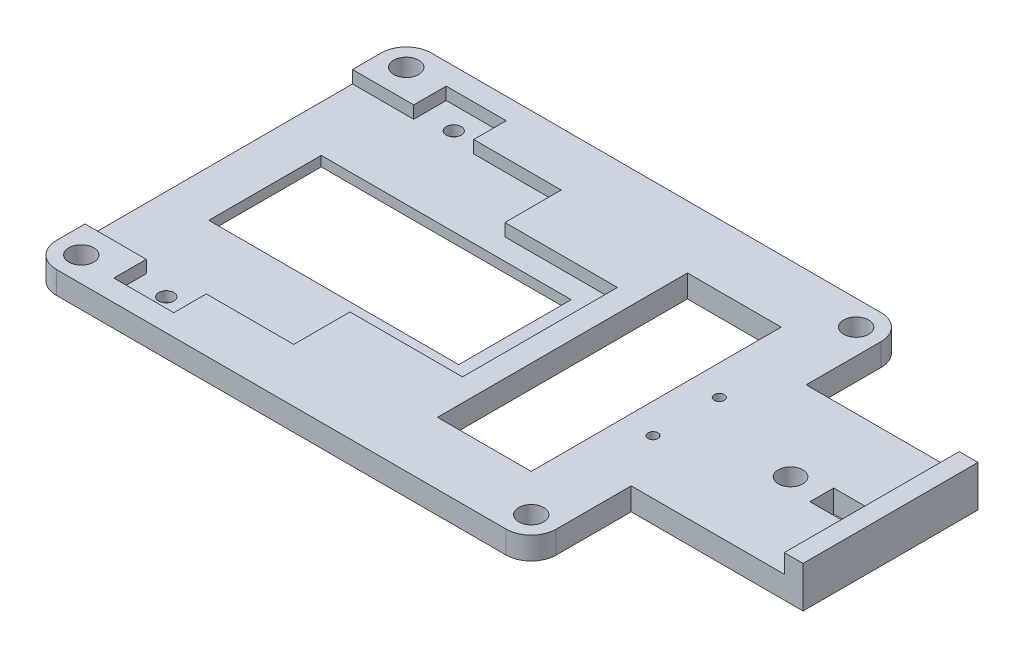
from build123d import *

# Parameters (mm, degrees)
SKETCH2_W                = 136.525
SKETCH2_H                = 76.2
CHASSIS_BASE_DEPTH       = 4.572
SKETCH2_2_W              = 136.525
SKETCH2_2_H              = 76.2
BOSS_EXTRUDE2_DEPTH      = 4.572
SKETCH4_W                = 34.925
SKETCH4_H                = 20.32
CORNER_CUTOUTS_DEPTH     = 79.308888961
CUT_EXTRUDE2_DEPTH       = 2.54
CIRCLE_R                 = 1.524
CIRCLE_THROUGH_ALL_DEPTH = 79.216561585
FILLET4_R                = 5.08
SKETCH10_W               = 50.8
SKETCH10_H               = 22.86
RESISTANCE_SENSOR_DEPTH  = 79.216561585
SKETCH11_R               = 2.54
CORNER_HOLES_DEPTH       = 79.308888961
CUT_EXTRUDE7_DEPTH       = 79.216561585
CUT_EXTRUDE7_DEPTH_BACK  = 79.216561585
SKETCH12_R               = 1.016
SKETCH12_W               = 19.05
SKETCH12_H               = 50.8
SKETCH16_W               = 6.35
SKETCH16_H               = 4.826
CUT_EXTRUDE11_DEPTH      = 79.308888961
SKETCH17_R               = 2.4892
CUT_EXTRUDE12_DEPTH      = 79.308888961
CUT_EXTRUDE13_DEPTH      = 1.27
SKETCH19_W               = 3.81
SKETCH19_H               = 35.56
BOSS_EXTRUDE4_DEPTH      = 3.81


with BuildPart() as part:
    # Sketch2 → Chassis Base (new body)
    with BuildSketch(Plane(origin=(0, 0, 0), x_dir=(1, 0, 0), z_dir=(0, 1, 0))):
        Rectangle(SKETCH2_W, SKETCH2_H)
    extrude(amount=CHASSIS_BASE_DEPTH)

    # Sketch2<2> → Boss-Extrude2 (add)
    with BuildSketch(Plane(origin=(0, 0, 0), x_dir=(1, 0, 0), z_dir=(0, 1, 0))):
        Rectangle(SKETCH2_2_W, SKETCH2_2_H)
    extrude(amount=BOSS_EXTRUDE2_DEPTH)

    # Sketch4 → Corner Cutouts (cut, through all)
    with BuildSketch(Plane.XZ):
        with Locations((50.8, -27.94)):
            Rectangle(SKETCH4_W, SKETCH4_H)
        with Locations((50.8, 27.94)):
            Rectangle(SKETCH4_W, SKETCH4_H)
    extrude(amount=-CORNER_CUTOUTS_DEPTH, mode=Mode.SUBTRACT)

    # Lines → Cut-Extrude2 (cut)
    with BuildSketch(Plane(origin=(0, 4.572, 0), x_dir=(1, 0, 0), z_dir=(0, 1, 0))):
        Polygon((-68.2625, -27.178), (-55.8165, -27.178), (-55.8165, -33.782), (-43.6245, -33.782), (-43.6245, -27.178), (-25.8445, -27.178), (-25.8445, -15.748), (-2.9845, -15.748), (-2.9845, 15.748), (-25.8445, 15.748), (-25.8445, 27.178), (-43.6245, 27.178), (-43.6245, 33.782), (-55.8165, 33.782), (-55.8165, 27.178), (-68.2625, 27.178), align=None)
    extrude(amount=-CUT_EXTRUDE2_DEPTH, mode=Mode.SUBTRACT)

    # Circle → Circle Through All (cut, through all)
    with BuildSketch(Plane(origin=(0, 2.032, 0), x_dir=(1, 0, 0), z_dir=(0, 1, 0))):
        with Locations((-49.7205, -29.21)):
            Circle(CIRCLE_R)
        with Locations((-49.7205, 29.21)):
            Circle(CIRCLE_R)
    extrude(amount=-CIRCLE_THROUGH_ALL_DEPTH, mode=Mode.SUBTRACT)

    # Fillet4
    fillet4_edges = [part.edges().sort_by_distance(p)[0] for p in [
        (33.3375, 2.286, -38.1),
        (-68.2625, 2.286, -38.1),
        (-68.2625, 2.286, 38.1),
        (33.3375, 2.286, 38.1),
    ]]
    fillet(fillet4_edges, radius=FILLET4_R)

    # Sketch10 → resistance sensor (cut, through all)
    with BuildSketch(Plane(origin=(0, 2.032, 0), x_dir=(1, 0, 0), z_dir=(0, 1, 0))):
        with Locations((-33.4645, 0)):
            Rectangle(SKETCH10_W, SKETCH10_H)
    extrude(amount=-RESISTANCE_SENSOR_DEPTH, mode=Mode.SUBTRACT)

    # Sketch11 → corner holes (cut, through all)
    with BuildSketch(Plane(origin=(0, 4.572, 0), x_dir=(1, 0, 0), z_dir=(0, 1, 0))):
        with Locations((-63.1825, 33.02)):
            Circle(SKETCH11_R)
        with Locations((28.2575, 33.02)):
            Circle(SKETCH11_R)
        with Locations((-63.1825, -33.02)):
            Circle(SKETCH11_R)
        with Locations((28.2575, -33.02)):
            Circle(SKETCH11_R)
    extrude(amount=-CORNER_HOLES_DEPTH, mode=Mode.SUBTRACT)

    # Sketch12 → Cut-Extrude7 (cut, two sides: drawn at the far end of the back side and taken through both)
    with BuildSketch(Plane(origin=(0, 2.032, 0), x_dir=(1, 0, 0), z_dir=(0, 1, 0)).offset(-CUT_EXTRUDE7_DEPTH_BACK)):
        with Locations((26.7335, -6.731)):
            Circle(SKETCH12_R)
        with Locations((26.7335, 6.731)):
            Circle(SKETCH12_R)
        with Locations((11.1125, 0)):
            Rectangle(SKETCH12_W, SKETCH12_H)
    extrude(amount=CUT_EXTRUDE7_DEPTH + CUT_EXTRUDE7_DEPTH_BACK, mode=Mode.SUBTRACT)

    # Sketch16 → Cut-Extrude11 (cut, through all)
    with BuildSketch(Plane(origin=(0, 4.572, 0), x_dir=(1, 0, 0), z_dir=(0, 1, 0))):
        with Locations((57.4675, 0)):
            Rectangle(SKETCH16_W, SKETCH16_H)
    extrude(amount=-CUT_EXTRUDE11_DEPTH, mode=Mode.SUBTRACT)

    # Sketch17 → Cut-Extrude12 (cut, through all)
    with BuildSketch(Plane(origin=(0, 4.572, 0), x_dir=(1, 0, 0), z_dir=(0, 1, 0))):
        with Locations((47.9425, 0)):
            Circle(SKETCH17_R)
    extrude(amount=-CUT_EXTRUDE12_DEPTH, mode=Mode.SUBTRACT)

    # Sketch18 → Cut-Extrude13 (cut)
    # profile 1 of 5: a face of its own
    with BuildSketch(Plane.XZ):
        with BuildLine():
            add(Edge.make_bspline(
                [(-33.702772205, -32.937203509), (-33.703598143, -33.02845504), (-33.705333053, -33.220131806), (-33.705378986, -33.521319359), (-33.709066322, -33.849800879), (-33.712761289, -34.138175691), (-33.714963296, -34.374614628), (-33.718439752, -34.546867394), (-33.721526048, -34.710761461), (-33.724612791, -34.865938747), (-33.72789546, -35.013090421), (-33.730587927, -35.151550246), (-33.735112427, -35.281601123), (-33.737993241, -35.365288069), (-33.739385689, -35.405738309)],
                knots=[0, 0, 0, 0, 1.330626348, 2.7950233, 4.391685999, 6.12059717, 7.000305762, 7.839416787, 8.632773681, 9.390544697, 10.102563453, 10.778998041, 11.409826442, 12, 12, 12, 12], degree=3))
            add(Edge.make_bspline(
                [(-33.739385689, -35.405738309), (-33.768327502, -35.409234362), (-33.83248073, -35.416983812), (-33.938141271, -35.429526589), (-34.062641053, -35.444079448), (-34.199605701, -35.460468397), (-34.336402659, -35.474890146), (-34.460092543, -35.489102134), (-34.564431712, -35.49920428), (-34.627550021, -35.505459716), (-34.65579444, -35.508258922)],
                knots=[0, 0, 0, 0, 0.75871927, 1.681798207, 2.769238559, 4.021041382, 5.271823924, 6.349219828, 7.26130266, 8, 8, 8, 8], degree=3))
            Line((-34.65579444, -35.508258922), (-34.690872443, -35.633794368))
            Line((-34.690872443, -35.633794368), (-31.888414176, -35.633794368))
            Line((-31.888414176, -35.633794368), (-31.917958117, -35.508258922))
            add(Edge.make_bspline(
                [(-31.917958117, -35.508258922), (-31.94519292, -35.505432324), (-32.007975814, -35.498916323), (-32.114793949, -35.488841023), (-32.24651708, -35.474708008), (-32.395177404, -35.460442989), (-32.543351452, -35.444452526), (-32.674806168, -35.429726522), (-32.781201209, -35.417460189), (-32.843906764, -35.409283924), (-32.871098858, -35.405738309)],
                knots=[0, 0, 0, 0, 0.685471795, 1.5801805, 2.685974342, 4.001975441, 5.318873838, 6.416921702, 7.313502363, 8, 8, 8, 8], degree=3))
            add(Edge.make_bspline(
                [(-32.871098858, -35.405738309), (-32.874138312, -35.320659894), (-32.880589906, -35.140071021), (-32.885476038, -34.853018948), (-32.894092619, -34.53434684), (-32.898315756, -34.19327846), (-32.902545611, -33.849452346), (-32.905663218, -33.522012459), (-32.907865964, -33.221075479), (-32.908471188, -33.02928289), (-32.908759492, -32.937920679)],
                knots=[0, 0, 0, 0, 0.827787113, 1.757074824, 2.79152534, 3.927552477, 5.073705597, 6.13505851, 7.111617519, 8, 8, 8, 8], degree=3))
            Line((-32.908759492, -32.937920679), (-32.907714385, -32.60758102))
            add(Edge.make_bspline(
                [(-32.907714385, -32.60758102), (-32.907861914, -32.531482837), (-32.908168994, -32.373085708), (-32.90565813, -32.126816918), (-32.902343534, -31.862847889), (-32.899826982, -31.634770862), (-32.894883149, -31.452080957), (-32.893441615, -31.324776533), (-32.890456586, -31.20968499), (-32.885676819, -31.107210678), (-32.882771665, -31.016875079), (-32.880052488, -30.938721487), (-32.875690702, -30.872484003), (-32.87252916, -30.8324094), (-32.871098858, -30.814279395)],
                knots=[0, 0, 0, 0, 1.527084951, 3.178602462, 4.942148896, 6.824739446, 7.755670849, 8.60950548, 9.379539168, 10.065885191, 10.668053807, 11.193301322, 11.635044395, 12, 12, 12, 12], degree=3))
            add(Edge.make_bspline(
                [(-32.871098858, -30.814279395), (-32.775178336, -30.816375101), (-32.582476854, -30.820585312), (-32.292786393, -30.839576476), (-32.001201884, -30.870593955), (-31.759192401, -30.903372857), (-31.571970644, -30.935633002), (-31.443807878, -30.959247373), (-31.329128742, -30.984449322), (-31.227090289, -31.009248014), (-31.138232094, -31.034937095), (-31.062429595, -31.062177121), (-30.999371199, -31.089458511), (-30.96348015, -31.111044647), (-30.947268158, -31.120795108)],
                knots=[0, 0, 0, 0, 1.761064907, 3.537927135, 5.327106968, 7.14307567, 8.01968469, 8.81438351, 9.535076163, 10.174712332, 10.74185694, 11.231870149, 11.653035633, 12, 12, 12, 12], degree=3))
            add(Edge.make_bspline(
                [(-30.947268158, -31.120795108), (-30.946391758, -31.143458533), (-30.944531559, -31.191562689), (-30.94543048, -31.268999734), (-30.944897718, -31.355826869), (-30.946533225, -31.486265533), (-30.951334144, -31.66062272), (-30.956246741, -31.802874042), (-30.958775574, -31.876100037)],
                knots=[0, 0, 0, 0, 0.540260251, 1.146727055, 1.844579267, 2.608938745, 4.254400499, 6, 6, 6, 6], degree=3))
            Line((-30.958775574, -31.876100037), (-30.832195022, -31.919036265))
            add(Edge.make_bspline(
                [(-30.832195022, -31.919036265), (-30.830117163, -31.896702772), (-30.825474294, -31.846799741), (-30.817475281, -31.76475329), (-30.805186845, -31.66832746), (-30.792868066, -31.557758279), (-30.779786175, -31.432781757), (-30.762290679, -31.294163583), (-30.7449934, -31.140982052), (-30.725461629, -30.97887355), (-30.706363399, -30.817020179), (-30.687561291, -30.665674785), (-30.669967123, -30.52964835), (-30.652898401, -30.409435499), (-30.638498637, -30.304389663), (-30.625125277, -30.214725705), (-30.612474102, -30.140517028), (-30.604513088, -30.096281615), (-30.600999555, -30.076758654)],
                knots=[0, 0, 0, 0, 0.579771428, 1.295469156, 2.130605229, 3.092125012, 4.171097047, 5.378518324, 6.703360754, 8.155632211, 9.598953579, 10.915923518, 12.097637568, 13.14415905, 14.054286067, 14.838241834, 15.487266906, 16, 16, 16, 16], degree=3))
            Line((-30.600999555, -30.076758654), (-30.781578329, -30.105475091))
            add(Edge.make_bspline(
                [(-30.781578329, -30.105475091), (-30.789518553, -30.143998715), (-30.806198417, -30.224924501), (-30.828331171, -30.345683623), (-30.849565879, -30.457079623), (-30.864513215, -30.52557071), (-30.870900762, -30.554839475)],
                knots=[0, 0, 0, 0, 1.030142935, 2.16400017, 3.215409641, 4, 4, 4, 4], degree=3))
            add(Edge.make_bspline(
                [(-30.870900762, -30.554839475), (-30.883445808, -30.556323123), (-30.914744569, -30.560024692), (-30.971651332, -30.563720773), (-31.04801904, -30.56788432), (-31.143925294, -30.571994272), (-31.259375172, -30.575769834), (-31.394276438, -30.581781204), (-31.549156013, -30.585026556), (-31.783795056, -30.592748084), (-32.095186039, -30.600485644), (-32.481227455, -30.606461873), (-32.878761634, -30.610774302), (-33.147973164, -30.611837885), (-33.284319699, -30.612376554)],
                knots=[0, 0, 0, 0, 0.188322618, 0.469847995, 0.849958105, 1.328735339, 1.901024075, 2.572223004, 3.341983892, 4.21063745, 6.072535026, 7.986090696, 9.967090691, 12, 12, 12, 12], degree=3))
            add(Edge.make_bspline(
                [(-33.284319699, -30.612376554), (-33.533303403, -30.610894644), (-34.02225272, -30.607984498), (-34.566956607, -30.596874691), (-34.912428586, -30.585010848), (-35.062078606, -30.581752933), (-35.193491765, -30.575756484), (-35.306850432, -30.571985279), (-35.402056205, -30.567834621), (-35.479468612, -30.563644403), (-35.538808582, -30.559958994), (-35.572210829, -30.55632018), (-35.585802864, -30.554839475)],
                knots=[0, 0, 0, 0, 3.244040555, 6.37058324, 7.0978683, 7.747816289, 8.32072437, 8.811738682, 9.225579453, 9.562275481, 9.82188124, 10, 10, 10, 10], degree=3))
            add(Edge.make_bspline(
                [(-35.585802864, -30.554839475), (-35.590559934, -30.513365183), (-35.600382748, -30.427725451), (-35.610618123, -30.301358685), (-35.619859633, -30.185947443), (-35.624570523, -30.114772548), (-35.626601884, -30.084081555)],
                knots=[0, 0, 0, 0, 1.059980831, 2.188740799, 3.218975397, 4, 4, 4, 4], degree=3))
            Line((-35.626601884, -30.084081555), (-35.778291568, -30.054858399))
            add(Edge.make_bspline(
                [(-35.778291568, -30.054858399), (-35.779109696, -30.1315546), (-35.780779991, -30.288138198), (-35.787694661, -30.52777808), (-35.802252217, -30.777410364), (-35.819070712, -31.030610979), (-35.839855131, -31.2738087), (-35.855139777, -31.494046279), (-35.872885045, -31.683923455), (-35.882635398, -31.800772007), (-35.887087933, -31.854131334)],
                knots=[0, 0, 0, 0, 1.020902502, 2.08428298, 3.190586408, 4.348989111, 5.461787099, 6.439309197, 7.287304727, 8, 8, 8, 8], degree=3))
            Line((-35.887087933, -31.854131334), (-35.725192363, -31.809162102))
            add(Edge.make_bspline(
                [(-35.725192363, -31.809162102), (-35.71545437, -31.74706555), (-35.695910507, -31.622439619), (-35.665327308, -31.440288698), (-35.635518725, -31.271767194), (-35.606395568, -31.168052242), (-35.593125765, -31.120795108)],
                knots=[0, 0, 0, 0, 1.07526635, 2.158027564, 3.160715617, 4, 4, 4, 4], degree=3))
            add(Edge.make_bspline(
                [(-35.593125765, -31.120795108), (-35.580361155, -31.112201424), (-35.552835473, -31.093669953), (-35.504809627, -31.068556822), (-35.44731879, -31.043847269), (-35.38048627, -31.01918181), (-35.304711923, -30.993420032), (-35.219034508, -30.970551023), (-35.124453848, -30.944772249), (-35.019973119, -30.919513038), (-34.904098663, -30.896616073), (-34.776123041, -30.875510362), (-34.635107521, -30.858141399), (-34.480918893, -30.843472759), (-34.313785766, -30.832525065), (-34.133859008, -30.822847413), (-33.940979163, -30.816637469), (-33.808085796, -30.815082992), (-33.739385689, -30.814279395)],
                knots=[0, 0, 0, 0, 0.389041187, 0.838930788, 1.368286178, 1.971244365, 2.640738876, 3.392006404, 4.213672846, 5.120859182, 6.110426022, 7.200997897, 8.401287125, 9.703895375, 11.118645378, 12.637995816, 14.261989656, 16, 16, 16, 16], degree=3))
            add(Edge.make_bspline(
                [(-33.739385689, -30.814279395), (-33.737942282, -30.830664591), (-33.734658791, -30.867937979), (-33.730430536, -30.930351173), (-33.727743346, -31.005717111), (-33.724503155, -31.093587246), (-33.721396793, -31.194367242), (-33.718365122, -31.308049063), (-33.71488523, -31.434966911), (-33.712742323, -31.618756603), (-33.708988428, -31.849591328), (-33.705457404, -32.117398445), (-33.70501216, -32.368478864), (-33.704206333, -32.530279453), (-33.703817312, -32.608390135)],
                knots=[0, 0, 0, 0, 0.329934336, 0.750541551, 1.254589287, 1.842509769, 2.514318579, 3.277018032, 4.123623988, 5.061003967, 6.963739231, 8.754478227, 10.433195345, 12, 12, 12, 12], degree=3))
            Line((-33.703817312, -32.608390135), (-33.702772205, -32.937203509))
        make_face()
    # profile 2 of 5: a face of its own
    with BuildSketch(Plane.XZ):
        with BuildLine():
            add(Edge.make_bspline(
                [(-27.251898172, -35.767698843), (-27.14067772, -35.764311776), (-26.922618032, -35.757671068), (-26.603830965, -35.716600121), (-26.29995869, -35.655080644), (-26.012210018, -35.566590368), (-25.739973448, -35.454956469), (-25.484537959, -35.317447754), (-25.243276324, -35.158734883), (-25.058153285, -35.004443988), (-24.918608884, -34.871624623), (-24.821536956, -34.765448835), (-24.73028793, -34.655561965), (-24.645253494, -34.541149573), (-24.566386092, -34.422046989), (-24.495969307, -34.29686386), (-24.429098445, -34.168454969), (-24.37125937, -34.03416413), (-24.318119325, -33.895936844), (-24.274151327, -33.752229577), (-24.233417449, -33.604654162), (-24.201673879, -33.451490367), (-24.175027198, -33.29383193), (-24.15719632, -33.131349802), (-24.142449612, -32.964669116), (-24.139507996, -32.851822621), (-24.138016377, -32.794601046)],
                knots=[0, 0, 0, 0, 1.654520043, 3.24386492, 4.775090929, 6.261827658, 7.715597549, 9.145277746, 10.571150381, 12.004552925, 12.72368617, 13.435937959, 14.143336704, 14.847838136, 15.555750295, 16.266773003, 16.983694851, 17.708494173, 18.440755566, 19.185660995, 19.943230337, 20.717524926, 21.511536697, 22.321039648, 23.148642092, 24, 24, 24, 24], degree=3))
            add(Edge.make_bspline(
                [(-24.138016377, -32.794601046), (-24.140608697, -32.706567622), (-24.145780113, -32.530949878), (-24.188341569, -32.270081443), (-24.256306284, -32.013806886), (-24.335599704, -31.805961834), (-24.411662626, -31.644829689), (-24.475552614, -31.528458756), (-24.546054751, -31.417207878), (-24.622286016, -31.310483813), (-24.705022118, -31.208407771), (-24.795273204, -31.112744285), (-24.890649221, -31.02087723), (-24.958527768, -30.964177657), (-24.992703534, -30.935630326)],
                knots=[0, 0, 0, 0, 1.497468564, 2.987297775, 4.485800779, 6.00346457, 6.76531872, 7.516957734, 8.261133263, 9.005498066, 9.747896811, 10.495259908, 11.242387355, 12, 12, 12, 12], degree=3))
            add(Edge.make_bspline(
                [(-24.992703534, -30.935630326), (-25.070246118, -30.885909145), (-25.222151893, -30.788505447), (-25.46169693, -30.67203661), (-25.70152636, -30.578019856), (-25.946993732, -30.513524114), (-26.197838356, -30.469689092), (-26.457591706, -30.437773454), (-26.728005827, -30.421213243), (-26.911981221, -30.421028741), (-27.005455175, -30.420935)],
                knots=[0, 0, 0, 0, 1.045468158, 2.048070122, 3.019776725, 3.967121396, 4.925071677, 5.910597291, 6.938419277, 8, 8, 8, 8], degree=3))
            add(Edge.make_bspline(
                [(-27.005455175, -30.420935), (-27.067546223, -30.422967782), (-27.19008247, -30.426979464), (-27.371116469, -30.439978031), (-27.546831513, -30.456762048), (-27.71694268, -30.482701932), (-27.88164765, -30.512809725), (-28.041245371, -30.54746318), (-28.194098466, -30.591900434), (-28.342995206, -30.637320101), (-28.485415938, -30.693076932), (-28.62356261, -30.751716604), (-28.755286785, -30.817985236), (-28.881711554, -30.889502), (-29.00262107, -30.966555992), (-29.118323138, -31.049543348), (-29.228384901, -31.138584721), (-29.366176208, -31.264407076), (-29.523971995, -31.431248144), (-29.691760883, -31.64365229), (-29.832359501, -31.869379538), (-29.949688599, -32.105407946), (-30.039676747, -32.353732723), (-30.104302518, -32.613159857), (-30.146663933, -32.883546862), (-30.152426812, -33.068179332), (-30.155348724, -33.161792223)],
                knots=[0, 0, 0, 0, 0.955876937, 1.886416398, 2.792499174, 3.671270352, 4.533252654, 5.369032349, 6.182765502, 6.982075569, 7.763369315, 8.534891058, 9.290804328, 10.030916141, 10.769236196, 11.495940819, 12.220840406, 12.946355399, 14.365929964, 15.749574664, 17.104431243, 18.45069603, 19.798521208, 21.15982306, 22.559965237, 24, 24, 24, 24], degree=3))
            add(Edge.make_bspline(
                [(-30.155348724, -33.161792223), (-30.15430078, -33.247295021), (-30.152242406, -33.415239842), (-30.12544672, -33.661577318), (-30.080784096, -33.897628672), (-30.015676038, -34.124589938), (-29.927459876, -34.345973854), (-29.807685562, -34.560273908), (-29.664977474, -34.774936399), (-29.550121962, -34.908262158), (-29.491056992, -34.976825537)],
                knots=[0, 0, 0, 0, 1.034515342, 2.031997759, 2.994717118, 3.939165266, 4.885977753, 5.871954466, 6.905642885, 8, 8, 8, 8], degree=3))
            add(Edge.make_bspline(
                [(-29.491056992, -34.976825537), (-29.448662443, -35.017134707), (-29.365323353, -35.096374365), (-29.233306218, -35.204229185), (-29.100080082, -35.302769582), (-28.96386678, -35.390007201), (-28.824948465, -35.465156686), (-28.685050486, -35.531750493), (-28.541914085, -35.586442729), (-28.349186902, -35.643489326), (-28.107923503, -35.698404191), (-27.819876596, -35.743318797), (-27.534927157, -35.768959701), (-27.346192823, -35.768117594), (-27.251898172, -35.767698843)],
                knots=[0, 0, 0, 0, 0.861291258, 1.693124039, 2.508722345, 3.300843965, 4.073052942, 4.833508039, 5.581284352, 6.327029741, 7.792114048, 9.221606161, 10.61839766, 12, 12, 12, 12], degree=3))
        make_face()
        with BuildLine():
            add(Edge.make_bspline(
                [(-26.895829263, -35.508258922), (-26.984523637, -35.502704186), (-27.158480619, -35.491809638), (-27.412028501, -35.445592731), (-27.652978609, -35.378433913), (-27.880543049, -35.285047473), (-28.095934044, -35.170064436), (-28.298367191, -35.030344156), (-28.488194237, -34.867806404), (-28.662417156, -34.682962493), (-28.820157571, -34.483230278), (-28.959925816, -34.273913906), (-29.078722386, -34.056063184), (-29.177689924, -33.830504178), (-29.255349712, -33.59618112), (-29.311737639, -33.353526538), (-29.347925153, -33.102844981), (-29.355445616, -32.932806754), (-29.359244775, -32.846907481)],
                knots=[0, 0, 0, 0, 1.062649301, 2.084182544, 3.077508181, 4.050770289, 5.021569289, 5.993828993, 6.988205842, 8.006520951, 9.028378007, 10.030629867, 11.014727188, 11.993884368, 12.974321098, 13.964231378, 14.971578057, 16, 16, 16, 16], degree=3))
            add(Edge.make_bspline(
                [(-29.359244775, -32.846907481), (-29.35434531, -32.754034104), (-29.344824985, -32.573568536), (-29.30825802, -32.312805485), (-29.253510281, -32.070964136), (-29.178885157, -31.84838559), (-29.086336977, -31.644304506), (-28.973393809, -31.459929079), (-28.843182536, -31.293698759), (-28.693654648, -31.148937999), (-28.533126646, -31.022731598), (-28.367229368, -30.912271687), (-28.197248711, -30.818141536), (-28.021526333, -30.742656122), (-27.841157941, -30.683934534), (-27.656366173, -30.641804376), (-27.466780141, -30.617133728), (-27.338893512, -30.614667924), (-27.274310253, -30.613422683)],
                knots=[0, 0, 0, 0, 1.302559707, 2.531050155, 3.684202301, 4.771875286, 5.814676407, 6.816822024, 7.794260883, 8.765083759, 9.724965173, 10.65181382, 11.554869737, 12.443376475, 13.327128818, 14.208934328, 15.095504675, 16, 16, 16, 16], degree=3))
            add(Edge.make_bspline(
                [(-27.274310253, -30.613422683), (-27.197799992, -30.61744998), (-27.04664853, -30.625406194), (-26.82455963, -30.664227035), (-26.612101487, -30.728594423), (-26.406715756, -30.811018916), (-26.212282085, -30.921209064), (-26.025044976, -31.050785247), (-25.847749195, -31.205194522), (-25.680585013, -31.3797719), (-25.526659194, -31.572849669), (-25.39172642, -31.782587468), (-25.27599895, -32.006708616), (-25.180397287, -32.245616611), (-25.105792988, -32.499432487), (-25.04922129, -32.767278919), (-25.012071835, -33.04958225), (-25.004099937, -33.242929353), (-25.000026435, -33.341726362)],
                knots=[0, 0, 0, 0, 0.932804582, 1.842821793, 2.737983766, 3.633357388, 4.532843208, 5.454388191, 6.403114053, 7.39159831, 8.39538157, 9.406392926, 10.424767149, 11.463676078, 12.536241667, 13.643519346, 14.795879348, 16, 16, 16, 16], degree=3))
            add(Edge.make_bspline(
                [(-25.000026435, -33.341726362), (-25.003348326, -33.417148103), (-25.009861674, -33.565030131), (-25.040127994, -33.781820346), (-25.084018741, -33.98897831), (-25.146541829, -34.186341439), (-25.224822755, -34.373748255), (-25.319647987, -34.551494654), (-25.429850191, -34.719922936), (-25.555732757, -34.876407326), (-25.693161744, -35.019875601), (-25.840833712, -35.145541302), (-25.996455962, -35.253482939), (-26.160914972, -35.341644137), (-26.332936809, -35.41230882), (-26.513705369, -35.463424881), (-26.702229511, -35.49791247), (-26.831302231, -35.504781043), (-26.895829263, -35.508258922)],
                knots=[0, 0, 0, 0, 1.134750352, 2.22494442, 3.287456516, 4.315732293, 5.333470747, 6.337539811, 7.341115772, 8.355823464, 9.353463168, 10.324393736, 11.266969937, 12.196088049, 13.125102564, 14.057913, 15.016630478, 16, 16, 16, 16], degree=3))
        make_face(mode=Mode.SUBTRACT)
    # profile 3 of 5: a face of its own
    with BuildSketch(Plane.XZ):
        with BuildLine():
            Line((-18.464989099, -35.633794368), (-16.107700484, -35.633794368))
            Line((-16.107700484, -35.633794368), (-16.1438522, -35.508258922))
            add(Edge.make_bspline(
                [(-16.1438522, -35.508258922), (-16.163277141, -35.505564373), (-16.204735866, -35.499813386), (-16.270648109, -35.488550282), (-16.345484558, -35.47881806), (-16.454008656, -35.462187112), (-16.588742339, -35.440487367), (-16.694543353, -35.417670957), (-16.745024775, -35.406784437)],
                knots=[0, 0, 0, 0, 0.578804289, 1.235344231, 1.973318314, 2.805923195, 4.475992485, 6, 6, 6, 6], degree=3))
            add(Edge.make_bspline(
                [(-16.745024775, -35.406784437), (-16.751708635, -35.380296951), (-16.766897974, -35.320103079), (-16.790721529, -35.219341766), (-16.817705292, -35.097511868), (-16.849164999, -34.955254925), (-16.884537912, -34.792364444), (-16.924528791, -34.608646148), (-16.968423092, -34.404365572), (-17.064727716, -33.941565386), (-17.215548353, -33.21846), (-17.363162332, -32.489037148), (-17.459343294, -32.004039138), (-17.504645776, -31.779253976), (-17.545381148, -31.571060065), (-17.582085206, -31.379981598), (-17.61407958, -31.206177288), (-17.644109263, -31.049806813), (-17.668653765, -30.910155793), (-17.684421225, -30.822643456), (-17.691771259, -30.781849405)],
                knots=[0, 0, 0, 0, 0.312451515, 0.710058559, 1.184198332, 1.7396684, 2.376473493, 3.090718614, 3.890202177, 4.766301273, 8.497490808, 12.338885421, 13.278308136, 14.152807913, 14.961608928, 15.704725426, 16.378254723, 16.982936425, 17.525893779, 18, 18, 18, 18], degree=3))
            add(Edge.make_bspline(
                [(-17.691771259, -30.781849405), (-17.669131533, -30.776837051), (-17.621182689, -30.76622135), (-17.544621814, -30.752177341), (-17.460128759, -30.735767102), (-17.370294443, -30.722326691), (-17.283087928, -30.709294518), (-17.205338409, -30.697694404), (-17.140485238, -30.688228141), (-17.10140849, -30.682798085), (-17.083970478, -30.68037492)],
                knots=[0, 0, 0, 0, 0.902777855, 1.912000022, 3.030478334, 4.253737315, 5.448096633, 6.463873442, 7.314503002, 8, 8, 8, 8], degree=3))
            Line((-17.083970478, -30.68037492), (-17.062183621, -30.553794368))
            Line((-17.062183621, -30.553794368), (-19.043467628, -30.553796411))
            Line((-19.043467628, -30.553796411), (-19.007310805, -30.679330835))
            add(Edge.make_bspline(
                [(-19.007310805, -30.679330835), (-18.969812338, -30.68561721), (-18.889058377, -30.699155088), (-18.763746293, -30.719945446), (-18.636241484, -30.743538155), (-18.554627723, -30.769567995), (-18.516120683, -30.781849405)],
                knots=[0, 0, 0, 0, 0.908126762, 1.955675498, 3.03544595, 4, 4, 4, 4], degree=3))
            add(Edge.make_bspline(
                [(-18.516120683, -30.781849405), (-18.519802807, -30.796191783), (-18.529053225, -30.832223438), (-18.550878132, -30.895353133), (-18.580033426, -30.979076947), (-18.617721208, -31.082782901), (-18.665159821, -31.206444983), (-18.721699548, -31.350308655), (-18.786329249, -31.51478305), (-18.939891874, -31.893578893), (-19.182848797, -32.487839471), (-19.43111394, -33.085070492), (-19.599397416, -33.478142366), (-19.676125472, -33.656177379), (-19.744565634, -33.817345434), (-19.807680598, -33.960363215), (-19.862719411, -34.086237875), (-19.91202828, -34.193774374), (-19.953965551, -34.284048902), (-19.979630465, -34.338349682), (-19.991162166, -34.362747984)],
                knots=[0, 0, 0, 0, 0.206330486, 0.518353994, 0.930327389, 1.442349601, 2.056186141, 2.776467501, 3.596923127, 4.519366629, 8.473700556, 12.545727429, 13.534334062, 14.433589585, 15.247961308, 15.974919263, 16.612542044, 17.162837773, 17.623848182, 18, 18, 18, 18], degree=3))
            add(Edge.make_bspline(
                [(-19.991162166, -34.362747984), (-20.010028796, -34.315337994), (-20.050492072, -34.213657751), (-20.114717847, -34.049919103), (-20.185014162, -33.863948044), (-20.265383659, -33.656579669), (-20.351458375, -33.426840922), (-20.446256614, -33.175313792), (-20.546886621, -32.90148121), (-20.654864135, -32.613092701), (-20.761844593, -32.323287047), (-20.863758017, -32.045870995), (-20.95627045, -31.787484977), (-21.042747426, -31.548990618), (-21.119601067, -31.32932801), (-21.189984897, -31.129742361), (-21.252064638, -30.949571312), (-21.289528115, -30.83559096), (-21.307192085, -30.781849405)],
                knots=[0, 0, 0, 0, 0.64193762, 1.376764149, 2.212685415, 3.143094487, 4.174628561, 5.299096029, 6.524724979, 7.844822574, 9.173146152, 10.411125717, 11.562902579, 12.625852621, 13.602639804, 14.490607553, 15.288323868, 16, 16, 16, 16], degree=3))
            add(Edge.make_bspline(
                [(-21.307192085, -30.781849405), (-21.268191378, -30.772533637), (-21.186283458, -30.752968986), (-21.056729302, -30.727467173), (-20.915260729, -30.701831993), (-20.816610901, -30.687716964), (-20.765297412, -30.68037492)],
                knots=[0, 0, 0, 0, 0.872324183, 1.832024741, 2.872310515, 4, 4, 4, 4], degree=3))
            Line((-20.765297412, -30.68037492), (-20.735509306, -30.553794368))
            Line((-20.735509306, -30.553794368), (-22.861410391, -30.553796411))
            Line((-22.861410391, -30.553796411), (-22.818024655, -30.679330835))
            add(Edge.make_bspline(
                [(-22.818024655, -30.679330835), (-22.801921181, -30.682189713), (-22.762897406, -30.689117674), (-22.694387817, -30.699067679), (-22.605857243, -30.711915111), (-22.502516692, -30.725331329), (-22.393437769, -30.740812038), (-22.288771037, -30.755073767), (-22.192569574, -30.768974845), (-22.131542771, -30.777673872), (-22.102249905, -30.781849405)],
                knots=[0, 0, 0, 0, 0.542804679, 1.315386201, 2.297446092, 3.511966529, 4.773923042, 5.954041894, 7.017940109, 8, 8, 8, 8], degree=3))
            add(Edge.make_bspline(
                [(-22.102249905, -30.781849405), (-22.10846636, -30.814639799), (-22.122236585, -30.887274616), (-22.146359616, -31.006527301), (-22.176234592, -31.146094654), (-22.207534841, -31.306605203), (-22.247564538, -31.486813022), (-22.289497885, -31.688296826), (-22.338198198, -31.909877321), (-22.443495575, -32.399653202), (-22.611150085, -33.145759988), (-22.77749708, -33.890326573), (-22.891839815, -34.370310081), (-22.940770275, -34.584544674), (-22.98912888, -34.77620332), (-23.029571805, -34.946555355), (-23.069358252, -35.094306017), (-23.102004467, -35.220505557), (-23.131352015, -35.324780037), (-23.150371899, -35.386588893), (-23.158839903, -35.414107338)],
                knots=[0, 0, 0, 0, 0.379247946, 0.840081546, 1.382532271, 2.001122798, 2.698273829, 3.480113498, 4.339723504, 5.276271099, 9.172834759, 13.029477518, 13.945454042, 14.779748709, 15.52649882, 16.191559413, 16.769196364, 17.265149568, 17.672830999, 18, 18, 18, 18], degree=3))
            add(Edge.make_bspline(
                [(-23.158839903, -35.414107338), (-23.201968987, -35.424744383), (-23.291202868, -35.446752379), (-23.426097946, -35.469477413), (-23.553983728, -35.489057801), (-23.634836377, -35.502274824), (-23.671442972, -35.508258922)],
                knots=[0, 0, 0, 0, 1.022016422, 2.114547405, 3.146348313, 4, 4, 4, 4], degree=3))
            Line((-23.671442972, -35.508258922), (-23.721894164, -35.633794368))
            Line((-23.721894164, -35.633794368), (-21.841846607, -35.633794368))
            Line((-21.841846607, -35.633794368), (-21.870769409, -35.508258922))
            add(Edge.make_bspline(
                [(-21.870769409, -35.508258922), (-21.889706112, -35.505897905), (-21.932427066, -35.500571481), (-22.003544453, -35.489629344), (-22.089344678, -35.477205488), (-22.185309703, -35.463376982), (-22.281929594, -35.448515407), (-22.370473241, -35.43367543), (-22.446561812, -35.420407712), (-22.493168935, -35.411051458), (-22.514424617, -35.406784437)],
                knots=[0, 0, 0, 0, 0.702734036, 1.585358755, 2.649590685, 3.895430199, 5.155876833, 6.249455525, 7.201645292, 8, 8, 8, 8], degree=3))
            add(Edge.make_bspline(
                [(-22.514424617, -35.406784437), (-22.51389444, -35.34086223), (-22.512796997, -35.204406087), (-22.500809766, -34.993107167), (-22.486397191, -34.767953267), (-22.460768553, -34.529615494), (-22.432277993, -34.276946679), (-22.395156553, -34.010940308), (-22.352085716, -33.730930947), (-22.30367346, -33.441525348), (-22.250895138, -33.150042351), (-22.201542654, -32.863886892), (-22.151755378, -32.58753126), (-22.10503763, -32.320643404), (-22.059154813, -32.063616479), (-22.013651825, -31.81618984), (-21.971056463, -31.578316087), (-21.943235928, -31.422778001), (-21.929638668, -31.346758909)],
                knots=[0, 0, 0, 0, 0.770431899, 1.594761011, 2.473197984, 3.407207202, 4.396093415, 5.445178443, 6.54618504, 7.70740775, 8.874723163, 10.008511827, 11.101454274, 12.156854393, 13.175424493, 14.153160355, 15.097358873, 16, 16, 16, 16], degree=3))
            Line((-21.929638668, -31.346758909), (-21.899693233, -31.346548458))
            add(Edge.make_bspline(
                [(-21.899693233, -31.346548458), (-21.893067649, -31.367237281), (-21.877290961, -31.416501022), (-21.845896451, -31.501097948), (-21.807740018, -31.61021163), (-21.759561764, -31.742707294), (-21.701791227, -31.8983655), (-21.635965354, -32.077760991), (-21.560545693, -32.280674123), (-21.387406027, -32.744172658), (-21.117515051, -33.465134924), (-20.844322951, -34.187962811), (-20.662377807, -34.660875179), (-20.580912373, -34.873774139), (-20.506491329, -35.064675209), (-20.441000794, -35.23444864), (-20.382124685, -35.381700925), (-20.33204521, -35.507780574), (-20.289286356, -35.61196107), (-20.263185256, -35.67425706), (-20.251648215, -35.701792734)],
                knots=[0, 0, 0, 0, 0.251873741, 0.599755847, 1.046100481, 1.592272547, 2.234489471, 2.971361359, 3.80808277, 4.744657452, 8.708649747, 12.734665194, 13.704869525, 14.584207812, 15.377909045, 16.080745818, 16.694199686, 17.216797744, 17.65381397, 18, 18, 18, 18], degree=3))
            add(Edge.make_bspline(
                [(-20.251648215, -35.701792734), (-20.239417209, -35.676349866), (-20.211505803, -35.61828872), (-20.165275515, -35.520351489), (-20.112918976, -35.400131684), (-20.050457029, -35.259579199), (-19.980854496, -35.097063485), (-19.901029869, -34.913729786), (-19.814619268, -34.708358861), (-19.620634823, -34.248399598), (-19.324532522, -33.539140091), (-19.02868709, -32.829223237), (-18.838408351, -32.36655658), (-18.752017618, -32.16002438), (-18.675288703, -31.97422503), (-18.605686063, -31.81001305), (-18.546262905, -31.666462036), (-18.495298388, -31.544287271), (-18.451995347, -31.443335406), (-18.426152113, -31.383025307), (-18.414646198, -31.356174068)],
                knots=[0, 0, 0, 0, 0.323097448, 0.737314984, 1.239386854, 1.823722409, 2.497644016, 3.262748589, 4.112229015, 5.047662212, 8.976026174, 12.908685672, 13.849949603, 14.701564875, 15.470904606, 16.150603782, 16.742804927, 17.24904711, 17.665661037, 18, 18, 18, 18], degree=3))
            Line((-18.414646198, -31.356174068), (-18.385448582, -31.355253597))
            add(Edge.make_bspline(
                [(-18.385448582, -31.355253597), (-18.380598966, -31.385211409), (-18.369922713, -31.451162434), (-18.350873822, -31.559193533), (-18.327753161, -31.685344024), (-18.301366403, -31.830365546), (-18.272714823, -31.993740419), (-18.238733126, -32.175676625), (-18.201117085, -32.375778474), (-18.119206279, -32.815508303), (-17.994920299, -33.481040352), (-17.873601109, -34.142736498), (-17.795052511, -34.565870031), (-17.763579877, -34.750980865), (-17.733363105, -34.914239752), (-17.709592281, -35.056629927), (-17.689757845, -35.17798459), (-17.673522035, -35.277942143), (-17.663354031, -35.356897534), (-17.657593015, -35.402250881), (-17.655156754, -35.421430239)],
                knots=[0, 0, 0, 0, 0.396651626, 0.873214011, 1.433742613, 2.072949179, 2.79980602, 3.601671395, 4.492008083, 5.461019541, 9.447939965, 13.341079234, 14.253823992, 15.072824383, 15.795194721, 16.423849787, 16.959593355, 17.402445839, 17.747301876, 18, 18, 18, 18], degree=3))
            add(Edge.make_bspline(
                [(-17.655156754, -35.421430239), (-17.680610271, -35.424239575), (-17.737794552, -35.430551074), (-17.832395201, -35.440493807), (-17.944829144, -35.455118019), (-18.068785136, -35.467971516), (-18.190621606, -35.483206067), (-18.297256141, -35.492059516), (-18.381387175, -35.50297238), (-18.430322365, -35.506674754), (-18.451260703, -35.508258922)],
                knots=[0, 0, 0, 0, 0.76741832, 1.724094307, 2.850468363, 4.164887635, 5.458538831, 6.529550762, 7.370825724, 8, 8, 8, 8], degree=3))
            Line((-18.451260703, -35.508258922), (-18.464989099, -35.633794368))
        make_face()
    # profile 4 of 5: a face of its own
    with BuildSketch(Plane.XZ):
        with BuildLine():
            add(Edge.make_bspline(
                [(-11.273772637, -33.242592385), (-11.274439814, -33.46115382), (-11.275786162, -33.902206147), (-11.282480344, -34.39657081), (-11.285896647, -34.720537359), (-11.289341456, -34.864893053), (-11.29239867, -34.993568473), (-11.295474487, -35.106554062), (-11.298717617, -35.203839765), (-11.301378408, -35.285481198), (-11.305587453, -35.35138628), (-11.308936635, -35.390050867), (-11.31038612, -35.406784437)],
                knots=[0, 0, 0, 0, 3.028851979, 6.112158886, 6.851591277, 7.518630885, 8.113202523, 8.635311525, 9.084965802, 9.462177826, 9.767237008, 10, 10, 10, 10], degree=3))
            add(Edge.make_bspline(
                [(-11.31038612, -35.406784437), (-11.340669603, -35.413676666), (-11.404442713, -35.428190811), (-11.506096785, -35.445473895), (-11.618077561, -35.461192403), (-11.735046224, -35.473718713), (-11.846702153, -35.48454033), (-11.942235024, -35.494077786), (-12.01694943, -35.500914626), (-12.059422349, -35.506092032), (-12.077198466, -35.508258922)],
                knots=[0, 0, 0, 0, 0.962742302, 2.02741116, 3.195519987, 4.468213233, 5.674133405, 6.673510737, 7.444826758, 8, 8, 8, 8], degree=3))
            Line((-12.077198466, -35.508258922), (-12.105332585, -35.633794368))
            Line((-12.105332585, -35.633794368), (-9.591677355, -35.633794368))
            Line((-9.591677355, -35.633794368), (-9.620759529, -35.508258922))
            add(Edge.make_bspline(
                [(-9.620759529, -35.508258922), (-9.644861692, -35.506147827), (-9.697206405, -35.501562983), (-9.781355568, -35.494624111), (-9.877223622, -35.484859855), (-10.019360231, -35.469949034), (-10.202608108, -35.446607325), (-10.348748271, -35.419980796), (-10.421176716, -35.406784437)],
                knots=[0, 0, 0, 0, 0.539497797, 1.17167315, 1.882709678, 2.688156165, 4.358618926, 6, 6, 6, 6], degree=3))
            add(Edge.make_bspline(
                [(-10.421176716, -35.406784437), (-10.423355065, -35.386916283), (-10.428241507, -35.342348331), (-10.434233417, -35.267687014), (-10.440733313, -35.178095367), (-10.44550472, -35.073079686), (-10.450734139, -34.953125476), (-10.456234584, -34.818191688), (-10.459974996, -34.66821944), (-10.465721545, -34.452039552), (-10.470511033, -34.181780099), (-10.474425787, -33.870373881), (-10.47809292, -33.581646695), (-10.478512648, -33.396823514), (-10.478713795, -33.308250243)],
                knots=[0, 0, 0, 0, 0.342636229, 0.768596579, 1.283965761, 1.882525891, 2.57066071, 3.342418964, 4.197626401, 5.142474103, 7.049835918, 8.831480119, 10.481542375, 12, 12, 12, 12], degree=3))
            Line((-10.478713795, -33.308250243), (-10.478713795, -33.089610364))
            add(Edge.make_bspline(
                [(-10.478713795, -33.089610364), (-10.416639799, -33.090443101), (-10.286877701, -33.092183891), (-10.083828243, -33.099281027), (-9.863818232, -33.113688047), (-9.67198871, -33.128315258), (-9.517590337, -33.143503593), (-9.409212409, -33.155056077), (-9.311515955, -33.171826032), (-9.222793972, -33.186236211), (-9.14481688, -33.205533307), (-9.076457714, -33.224862378), (-9.018068374, -33.246423454), (-8.983992265, -33.264331882), (-8.968103936, -33.272681867)],
                knots=[0, 0, 0, 0, 1.460054225, 3.052158871, 4.777747245, 6.645306086, 7.576443567, 8.426900201, 9.207584446, 9.907398832, 10.539969914, 11.095367996, 11.578206203, 12, 12, 12, 12], degree=3))
            add(Edge.make_bspline(
                [(-8.968103936, -33.272681867), (-8.962561471, -33.328449649), (-8.951522119, -33.439526604), (-8.940801705, -33.602469271), (-8.932781771, -33.753125616), (-8.931895168, -33.848392904), (-8.931489431, -33.891990064)],
                knots=[0, 0, 0, 0, 1.083509771, 2.158109244, 3.157095713, 4, 4, 4, 4], degree=3))
            Line((-8.931489431, -33.891990064), (-8.804908879, -33.934677019))
            add(Edge.make_bspline(
                [(-8.804908879, -33.934677019), (-8.799588577, -33.79139919), (-8.788796492, -33.500764095), (-8.76600663, -33.139197996), (-8.741508755, -32.857016318), (-8.725764298, -32.664365998), (-8.707398049, -32.492565556), (-8.695444891, -32.384863286), (-8.689833699, -32.334304413)],
                knots=[0, 0, 0, 0, 1.60798525, 3.261753419, 4.062339447, 4.784657842, 5.429479703, 6, 6, 6, 6], degree=3))
            Line((-8.689833699, -32.334304413), (-8.834806297, -32.355688755))
            add(Edge.make_bspline(
                [(-8.834806297, -32.355688755), (-8.841162933, -32.393208366), (-8.854204265, -32.470183942), (-8.874835685, -32.584343747), (-8.893411103, -32.693466476), (-8.9108653, -32.761908325), (-8.918935887, -32.793554917)],
                knots=[0, 0, 0, 0, 1.023788563, 2.100413966, 3.12165692, 4, 4, 4, 4], degree=3))
            add(Edge.make_bspline(
                [(-8.918935887, -32.793554917), (-8.938420064, -32.798295683), (-8.98063964, -32.808568282), (-9.049196875, -32.820331131), (-9.126870842, -32.832441624), (-9.213996079, -32.840528152), (-9.310011055, -32.85223217), (-9.415459448, -32.859740353), (-9.530169842, -32.867343622), (-9.691301994, -32.875082651), (-9.88763612, -32.883149939), (-10.106931879, -32.892301189), (-10.301202341, -32.896537154), (-10.422221433, -32.896935642), (-10.478713795, -32.897121659)],
                knots=[0, 0, 0, 0, 0.460983456, 0.998888806, 1.598786594, 2.26823328, 3.010291425, 3.822708578, 4.698538602, 5.653966456, 7.532036023, 9.217167566, 10.700958888, 12, 12, 12, 12], degree=3))
            Line((-10.478713795, -32.897121659), (-10.478713795, -32.733950099))
            add(Edge.make_bspline(
                [(-10.478713795, -32.733950099), (-10.478514722, -32.649901729), (-10.478095935, -32.473090198), (-10.474314584, -32.195167563), (-10.470871811, -31.891415555), (-10.464444148, -31.626414509), (-10.459093553, -31.414053019), (-10.454838831, -31.268642075), (-10.450968919, -31.140292137), (-10.446038449, -31.028670128), (-10.439143494, -30.934242214), (-10.434594431, -30.856736777), (-10.428875692, -30.796249645), (-10.422744129, -30.761948022), (-10.420130587, -30.747327158)],
                knots=[0, 0, 0, 0, 1.521705457, 3.201193203, 5.032271395, 7.021502972, 8.000415413, 8.878349948, 9.65531632, 10.325287411, 10.901059933, 11.369321384, 11.731176961, 12, 12, 12, 12], degree=3))
            add(Edge.make_bspline(
                [(-10.420130587, -30.747327158), (-10.391535004, -30.747567794), (-10.331538929, -30.74807267), (-10.236987251, -30.751118505), (-10.133798396, -30.757878592), (-10.021443573, -30.765885526), (-9.900508038, -30.777915751), (-9.770689123, -30.791036733), (-9.632369814, -30.808491416), (-9.488477684, -30.826070466), (-9.345740235, -30.847607891), (-9.210775473, -30.871879082), (-9.087217539, -30.901962296), (-8.973935472, -30.932259691), (-8.872304793, -30.967904878), (-8.781837865, -31.006760732), (-8.701668904, -31.047645138), (-8.654660504, -31.080200199), (-8.63229662, -31.095688019)],
                knots=[0, 0, 0, 0, 0.745412212, 1.563941097, 2.465474235, 3.44078858, 4.499925893, 5.633228068, 6.841852836, 8.133904223, 9.411712824, 10.604407001, 11.706776453, 12.725636009, 13.659933344, 14.510926994, 15.291584992, 16, 16, 16, 16], degree=3))
            add(Edge.make_bspline(
                [(-8.63229662, -31.095688019), (-8.629278376, -31.116585158), (-8.62285629, -31.161049178), (-8.617574806, -31.232382279), (-8.610767846, -31.311817923), (-8.606009732, -31.396602302), (-8.602204948, -31.479957753), (-8.598372539, -31.556301247), (-8.597983419, -31.622244011), (-8.597119571, -31.663039516), (-8.596728244, -31.681520097)],
                knots=[0, 0, 0, 0, 0.862638942, 1.835485362, 2.921946333, 4.121165674, 5.305387793, 6.332364251, 7.244552155, 8, 8, 8, 8], degree=3))
            Line((-8.596728244, -31.681520097), (-8.470147691, -31.740086959))
            add(Edge.make_bspline(
                [(-8.470147691, -31.740086959), (-8.469114218, -31.66511002), (-8.466984039, -31.510568725), (-8.456574037, -31.272081348), (-8.444102646, -31.020307548), (-8.429364282, -30.763225552), (-8.410402614, -30.516059505), (-8.392712793, -30.294095188), (-8.372066091, -30.104659011), (-8.355358679, -29.989891974), (-8.34774961, -29.937623535)],
                knots=[0, 0, 0, 0, 0.995506361, 2.051922148, 3.169085537, 4.342481069, 5.470604041, 6.460265785, 7.298757679, 8, 8, 8, 8], degree=3))
            Line((-8.34774961, -29.937623535), (-8.502890294, -29.973444249))
            add(Edge.make_bspline(
                [(-8.502890294, -29.973444249), (-8.508240768, -30.018708073), (-8.51945588, -30.113585423), (-8.535627366, -30.23268999), (-8.548922363, -30.327188868), (-8.558687532, -30.389903915), (-8.566589526, -30.442289007), (-8.572262036, -30.473948244), (-8.574759541, -30.487887237)],
                knots=[0, 0, 0, 0, 1.579215329, 3.310187927, 4.164533577, 4.885633696, 5.509364535, 6, 6, 6, 6], degree=3))
            add(Edge.make_bspline(
                [(-8.574759541, -30.487887237), (-8.595634174, -30.492044166), (-8.644058075, -30.501687195), (-8.727817815, -30.509278528), (-8.831928762, -30.519793066), (-8.956947976, -30.525669209), (-9.102628421, -30.533945247), (-9.269028386, -30.538381156), (-9.45628143, -30.54269733), (-9.657845501, -30.545632076), (-9.861150216, -30.547401181), (-10.053638749, -30.549430434), (-10.229032566, -30.551904934), (-10.387352686, -30.552663109), (-10.528580167, -30.553630992), (-10.652717311, -30.555097589), (-10.759773918, -30.5547901), (-10.825331174, -30.554823978), (-10.855320131, -30.554839475)],
                knots=[0, 0, 0, 0, 0.447197082, 1.037384759, 1.766156545, 2.647384005, 3.667698219, 4.833919275, 6.146513728, 7.60556834, 9.071861591, 10.420863621, 11.652575644, 12.759595974, 13.749321587, 14.621753255, 15.369525425, 16, 16, 16, 16], degree=3))
            add(Edge.make_bspline(
                [(-10.855320131, -30.554839475), (-10.897514846, -30.554562531), (-10.989230544, -30.553960558), (-11.137072466, -30.551350159), (-11.305872962, -30.550071881), (-11.487873248, -30.545139001), (-11.668886728, -30.541919701), (-11.834506052, -30.536277933), (-11.97748881, -30.53131207), (-12.065344837, -30.527354279), (-12.105443941, -30.525547871)],
                knots=[0, 0, 0, 0, 0.809799648, 1.760204837, 2.837753184, 4.049360768, 5.254277663, 6.312195211, 7.229654905, 8, 8, 8, 8], degree=3))
            Line((-12.105443941, -30.525547871), (-12.076408761, -30.705522874))
            add(Edge.make_bspline(
                [(-12.076408761, -30.705522874), (-12.044948527, -30.708742486), (-11.979003298, -30.715491262), (-11.87590168, -30.724072309), (-11.764426734, -30.736372009), (-11.649222221, -30.74773049), (-11.539700596, -30.760914325), (-11.445237915, -30.773548528), (-11.370748001, -30.788665589), (-11.328453932, -30.801481572), (-11.31038612, -30.806956494)],
                knots=[0, 0, 0, 0, 0.98083855, 2.055980328, 3.208571069, 4.459097211, 5.646332609, 6.629822294, 7.414667014, 8, 8, 8, 8], degree=3))
            add(Edge.make_bspline(
                [(-11.31038612, -30.806956494), (-11.308950382, -30.825783654), (-11.305734967, -30.867948092), (-11.301397129, -30.938374683), (-11.298762559, -31.022805207), (-11.295504514, -31.121136133), (-11.292422412, -31.23307523), (-11.289348677, -31.358960541), (-11.28590456, -31.498782579), (-11.283721338, -31.701748745), (-11.279951948, -31.958388981), (-11.276447078, -32.259324184), (-11.276002842, -32.546669315), (-11.275206836, -32.733577105), (-11.274817744, -32.824938778)],
                knots=[0, 0, 0, 0, 0.33675085, 0.754171678, 1.258263211, 1.84315515, 2.508859089, 3.255382855, 4.0889495, 5.003240078, 6.875350917, 8.666545496, 10.370587017, 12, 12, 12, 12], degree=3))
            Line((-11.274817744, -32.824938778), (-11.273772637, -33.242592385))
        make_face()
    # profile 5 of 5: a face of its own
    with BuildSketch(Plane.XZ):
        with BuildLine():
            add(Edge.make_bspline(
                [(-6.921877198, -33.612442814), (-6.921590313, -33.692443095), (-6.921029137, -33.848931601), (-6.89570709, -34.077011264), (-6.856366935, -34.292525459), (-6.80153574, -34.495775812), (-6.727932009, -34.685480541), (-6.638449828, -34.862926828), (-6.532749228, -35.027792425), (-6.409700667, -35.179449579), (-6.269202346, -35.316666667), (-6.108529731, -35.435457357), (-5.928964151, -35.536535103), (-5.730285349, -35.618693343), (-5.51283193, -35.683326993), (-5.276633699, -35.731421435), (-5.021041201, -35.76009415), (-4.844336086, -35.765802524), (-4.753251359, -35.768744972)],
                knots=[0, 0, 0, 0, 1.098480814, 2.148737736, 3.147644891, 4.10655949, 5.03634168, 5.93840556, 6.832815652, 7.721755294, 8.616242375, 9.523684943, 10.459066836, 11.44050601, 12.471205295, 13.571501156, 14.748201731, 16, 16, 16, 16], degree=3))
            add(Edge.make_bspline(
                [(-4.753251359, -35.768744972), (-4.66602375, -35.767411804), (-4.49827547, -35.764847976), (-4.257242462, -35.743432205), (-4.037088132, -35.711209787), (-3.837469708, -35.664222914), (-3.656356977, -35.603176889), (-3.491792983, -35.528753033), (-3.341362545, -35.442712288), (-3.252693376, -35.373005412), (-3.209165381, -35.338786071)],
                knots=[0, 0, 0, 0, 1.279578065, 2.460769273, 3.547596216, 4.541609226, 5.465453356, 6.347033297, 7.188553055, 8, 8, 8, 8], degree=3))
            add(Edge.make_bspline(
                [(-3.209165381, -35.338786071), (-3.176006395, -35.306735019), (-3.110172703, -35.243101013), (-3.018693335, -35.141512093), (-2.936764391, -35.034364638), (-2.860115413, -34.924794464), (-2.794891564, -34.808844698), (-2.735737757, -34.689733482), (-2.685737764, -34.565718417), (-2.628030725, -34.393726668), (-2.573565037, -34.168176159), (-2.525921234, -33.886496108), (-2.49977553, -33.591213221), (-2.498465371, -33.389896585), (-2.497797857, -33.287327669)],
                knots=[0, 0, 0, 0, 0.74095243, 1.471083405, 2.194018666, 2.907422796, 3.617739347, 4.329446966, 5.043269096, 5.764464961, 7.243103234, 8.765857475, 10.352235051, 12, 12, 12, 12], degree=3))
            add(Edge.make_bspline(
                [(-2.497797857, -33.287327669), (-2.498277062, -33.21583868), (-2.499277656, -33.066567778), (-2.505168021, -32.838539572), (-2.511044655, -32.606325078), (-2.511983715, -32.451823241), (-2.512443659, -32.376149561)],
                knots=[0, 0, 0, 0, 0.941350568, 1.96556493, 3.003551083, 4, 4, 4, 4], degree=3))
            Line((-2.512443659, -32.376149561), (-2.512030929, -32.020008118))
            add(Edge.make_bspline(
                [(-2.512030929, -32.020008118), (-2.511810625, -31.981802847), (-2.511308813, -31.894778019), (-2.510703685, -31.74811013), (-2.506734043, -31.569238247), (-2.504497129, -31.402873877), (-2.499593602, -31.263433546), (-2.49830065, -31.165058053), (-2.49480963, -31.076849556), (-2.49158598, -30.998748527), (-2.489160585, -30.930678461), (-2.48400374, -30.872903453), (-2.481915154, -30.824984034), (-2.478415275, -30.796482643), (-2.476875283, -30.783941663)],
                knots=[0, 0, 0, 0, 1.112001644, 2.532942425, 4.268742887, 6.319307057, 7.375275201, 8.329527021, 9.182613282, 9.944420855, 10.604828803, 11.164515616, 11.632376063, 12, 12, 12, 12], degree=3))
            add(Edge.make_bspline(
                [(-2.476875283, -30.783941663), (-2.429521024, -30.773140167), (-2.337154385, -30.752071359), (-2.202417231, -30.727217928), (-2.080849412, -30.704228195), (-2.005043541, -30.68783462), (-1.970548987, -30.68037492)],
                knots=[0, 0, 0, 0, 1.127559202, 2.199355566, 3.180638315, 4, 4, 4, 4], degree=3))
            Line((-1.970548987, -30.68037492), (-1.926323487, -30.553794368))
            Line((-1.926323487, -30.553794368), (-3.998993579, -30.553796411))
            Line((-3.998993579, -30.553796411), (-3.94727457, -30.679330835))
            add(Edge.make_bspline(
                [(-3.94727457, -30.679330835), (-3.918827146, -30.68206314), (-3.857911872, -30.687913902), (-3.761128757, -30.698462497), (-3.652613433, -30.710864976), (-3.537292775, -30.726353034), (-3.422548973, -30.74153093), (-3.317088857, -30.755559901), (-3.225213017, -30.770740203), (-3.168369934, -30.779781321), (-3.142213143, -30.783941663)],
                knots=[0, 0, 0, 0, 0.84468969, 1.808757977, 2.877550512, 4.072885772, 5.247783381, 6.298734727, 7.217149455, 8, 8, 8, 8], degree=3))
            add(Edge.make_bspline(
                [(-3.142213143, -30.783941663), (-3.14034068, -30.807296994), (-3.136263689, -30.858149517), (-3.132623242, -30.940855506), (-3.128349239, -31.036394916), (-3.123952143, -31.144830108), (-3.121202729, -31.266554358), (-3.118060423, -31.401154841), (-3.114576868, -31.548648645), (-3.113131599, -31.704537759), (-3.110459036, -31.860400445), (-3.110278245, -32.007922099), (-3.107551635, -32.142158572), (-3.106303828, -32.263513754), (-3.107142284, -32.371272154), (-3.105267715, -32.466112892), (-3.105662531, -32.547715017), (-3.105618719, -32.597928957), (-3.105598638, -32.62094368)],
                knots=[0, 0, 0, 0, 0.611962318, 1.332450699, 2.162118907, 3.110096843, 4.16702893, 5.342335118, 6.62691553, 8.020625594, 9.414335659, 10.698657708, 11.87378741, 12.921297375, 13.868574921, 14.688384936, 15.398843096, 16, 16, 16, 16], degree=3))
            Line((-3.105598638, -32.62094368), (-3.104969327, -33.301362548))
            add(Edge.make_bspline(
                [(-3.104969327, -33.301362548), (-3.105722492, -33.408984213), (-3.107174716, -33.616496022), (-3.123012077, -33.916412967), (-3.15448595, -34.192997999), (-3.191235539, -34.409068271), (-3.230511513, -34.569436648), (-3.265249758, -34.681292377), (-3.305449025, -34.78683003), (-3.353370307, -34.885599848), (-3.40518491, -34.979151803), (-3.464083186, -35.066208177), (-3.528796372, -35.147100389), (-3.576644198, -35.196185471), (-3.600417519, -35.220573527)],
                knots=[0, 0, 0, 0, 1.903911934, 3.671047141, 5.310184092, 6.826502457, 7.544698343, 8.229584924, 8.897507391, 9.540432076, 10.170199064, 10.787884533, 11.397757162, 12, 12, 12, 12], degree=3))
            add(Edge.make_bspline(
                [(-3.600417519, -35.220573527), (-3.632188008, -35.249292207), (-3.695851197, -35.306840039), (-3.803683351, -35.37859025), (-3.919790362, -35.439722711), (-4.045130573, -35.490288489), (-4.181832676, -35.529308142), (-4.331185307, -35.555574964), (-4.49340832, -35.572795916), (-4.606048096, -35.574387592), (-4.664330418, -35.57521116)],
                knots=[0, 0, 0, 0, 0.892216608, 1.787865285, 2.692300372, 3.625548977, 4.601601837, 5.65154391, 6.784856638, 8, 8, 8, 8], degree=3))
            add(Edge.make_bspline(
                [(-4.664330418, -35.57521116), (-4.71462001, -35.575443793), (-4.813547884, -35.57590142), (-4.958687066, -35.554604334), (-5.097910901, -35.52071517), (-5.230349733, -35.469713626), (-5.357465774, -35.404487506), (-5.477512135, -35.322473635), (-5.591326949, -35.225183245), (-5.698961438, -35.112526503), (-5.798519714, -34.981515949), (-5.882466819, -34.827475387), (-5.956387404, -34.653998444), (-6.014534202, -34.458175521), (-6.062759278, -34.241864557), (-6.097755687, -34.00413375), (-6.119179964, -33.745203543), (-6.12420942, -33.565638464), (-6.126818356, -33.47249245)],
                knots=[0, 0, 0, 0, 0.831978421, 1.636637964, 2.422585838, 3.201433073, 3.981650011, 4.784316689, 5.603829326, 6.457736919, 7.361162631, 8.320562619, 9.35588812, 10.479611967, 11.698851246, 13.024714807, 14.456626667, 16, 16, 16, 16], degree=3))
            Line((-6.126818356, -33.47249245), (-6.126818356, -32.486628517))
            add(Edge.make_bspline(
                [(-6.126818356, -32.486628517), (-6.126328485, -32.314503761), (-6.125339376, -31.96696344), (-6.12138346, -31.577204841), (-6.114037073, -31.321663759), (-6.112547672, -31.207608583), (-6.10960346, -31.106112067), (-6.104809617, -31.017244857), (-6.101978445, -30.941199359), (-6.099164661, -30.877685814), (-6.095027477, -30.826770445), (-6.091656299, -30.796837888), (-6.090203851, -30.783941663)],
                knots=[0, 0, 0, 0, 3.031320133, 6.120595302, 6.86389742, 7.53339059, 8.129362652, 8.651934286, 9.100613388, 9.469540013, 9.771455147, 10, 10, 10, 10], degree=3))
            add(Edge.make_bspline(
                [(-6.090203851, -30.783941663), (-6.02646225, -30.772668901), (-5.894434014, -30.749319584), (-5.69494302, -30.723222882), (-5.502744773, -30.699948154), (-5.37919787, -30.686543384), (-5.322345377, -30.68037492)],
                knots=[0, 0, 0, 0, 1.002171925, 2.075802739, 3.11454347, 4, 4, 4, 4], degree=3))
            Line((-5.322345377, -30.68037492), (-5.284553978, -30.553794368))
            Line((-5.284553978, -30.553794368), (-7.550970377, -30.553796411))
            Line((-7.550970377, -30.553796411), (-7.529277509, -30.679330835))
            add(Edge.make_bspline(
                [(-7.529277509, -30.679330835), (-7.479189173, -30.687308093), (-7.378827087, -30.703292138), (-7.230235822, -30.727734541), (-7.08974538, -30.753369809), (-7.00026905, -30.774210642), (-6.958490682, -30.783941663)],
                knots=[0, 0, 0, 0, 1.048533566, 2.100948571, 3.1132932, 4, 4, 4, 4], degree=3))
            add(Edge.make_bspline(
                [(-6.958490682, -30.783941663), (-6.957065785, -30.800328192), (-6.953944945, -30.836218333), (-6.949537539, -30.895126691), (-6.946896698, -30.96387386), (-6.943636104, -31.042326831), (-6.940544234, -31.130205217), (-6.93748516, -31.22749706), (-6.934011444, -31.334536154), (-6.930549216, -31.574468275), (-6.923453906, -31.949994092), (-6.923101569, -32.2865259), (-6.922922306, -32.457747601)],
                knots=[0, 0, 0, 0, 0.294690285, 0.645437246, 1.058192809, 1.527124121, 2.052242108, 2.633554529, 3.271067089, 3.970889855, 6.932490569, 10, 10, 10, 10], degree=3))
            Line((-6.922922306, -32.457747601), (-6.921877198, -33.612442814))
        make_face()
    extrude(amount=-CUT_EXTRUDE13_DEPTH, mode=Mode.SUBTRACT)

    # Sketch19 → Boss-Extrude4 (add)
    with BuildSketch(Plane(origin=(0, 4.572, 0), x_dir=(1, 0, 0), z_dir=(0, 1, 0))):
        with Locations((66.3575, 0)):
            Rectangle(SKETCH19_W, SKETCH19_H)
    extrude(amount=BOSS_EXTRUDE4_DEPTH)


solid = part.part
